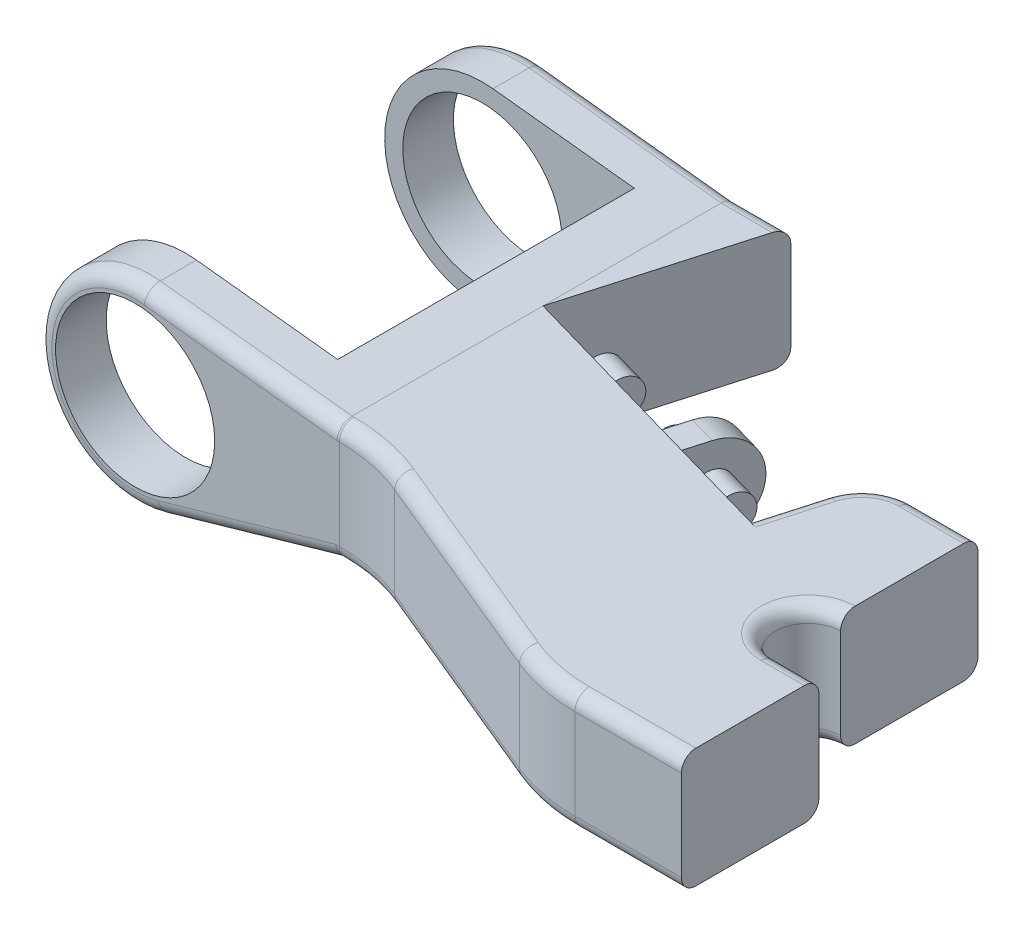
from build123d import *

# Parameters (mm, degrees)
EXTRUDE_1_DEPTH          = 13.5
CUT_EXTRUDE_1_DEPTH      = 136.073128342
CUT_EXTRUDE_1_DEPTH_BACK = 136.073128342
SKETCH_11_R              = 11
SKETCH_12_R              = 2.5
EXTRUDE_2_DEPTH          = 4.5
SKETCH_13_R              = 2.5
EXTRUDE_3_DEPTH          = 4.5
FILLET_1_R               = 25
EXTRUDE_START            = 4.5
EXTRUDE_5_DEPTH          = 4.5
EXTRUDE_6_DEPTH          = 4.5
CUT_EXTRUDE_5_DEPTH      = 4
FILLET_6_R               = 2


with BuildPart() as part:
    # Эскиз10 → Бобышка-Вытянуть1 (new, symmetric)
    with BuildSketch(Plane(origin=(0, 0, 0), x_dir=(1, 0, 0), z_dir=(0, 1, 0))):
        with BuildLine():
            Line((-78, 61.5), (-92.5, 61.5))
            Line((-92.5, 61.5), (-119.5, 61.5))
            Line((-119.5, 61.5), (-119.5, 54.5))
            Line((-119.5, 54.5), (-92.5, 54.5))
            Line((-92.5, 54.5), (-85, 54.5))
            Line((-85, 54.5), (-85, 13.5))
            Line((-85, 13.5), (-92.5, 13.5))
            Line((-92.5, 13.5), (-119.5, 13.5))
            Line((-119.5, 13.5), (-119.5, 6.5))
            Line((-119.5, 6.5), (-92.5, 6.5))
            Line((-92.5, 6.5), (-72.806349184, 6.5))
            Line((-72.806349184, 6.5), (-53.492640685, -1.5))
            Line((-53.492640685, -1.5), (-34.178932186, -9.5))
            Line((-34.178932186, -9.5), (-14.48528137, -9.5))
            Line((-14.48528137, -9.5), (-14.48528137, 9.5))
            Line((-14.48528137, 9.5), (-20.48528137, 9.5))
            ThreePointArc((-20.48528137, 9.5), (-24.98528137, 14), (-20.48528137, 18.5))
            Line((-20.48528137, 18.5), (-20.48528137, 37.5))
            Line((-20.48528137, 37.5), (-29.380741372, 37.5))
            ThreePointArc((-29.380741372, 37.5), (-33.710759363, 36.051196247), (-36.296953626, 32.288260244))
            Line((-36.296953626, 32.288260244), (-38.777689828, 23.636904981))
            Line((-38.777689828, 23.636904981), (-56.466321522, 28.7090385))
            Line((-56.466321522, 28.7090385), (-53.020854575, 40.724809699))
            Line((-53.020854575, 40.724809699), (-56.865901358, 41.827359122))
            Line((-56.865901358, 41.827359122), (-60.311368306, 29.811587923))
            Line((-60.311368306, 29.811587923), (-78, 34.883721442))
            Line((-78, 34.883721442), (-75.519263798, 43.535076705))
            Line((-75.519263798, 43.535076705), (-70.367904937, 61.5))
            Line((-70.367904937, 61.5), (-78, 61.5))
        make_face()
    extrude(amount=EXTRUDE_1_DEPTH, both=True)

    # Эскиз11 → Вырез-Вытянуть1 (cut, two sides: drawn at the far end of the back side and taken through both)
    with BuildSketch(Plane.XY.offset(-CUT_EXTRUDE_1_DEPTH_BACK)):
        with BuildLine():
            Line((-11.66726189, -13.5), (-11.66726189, -6))
            Line((-11.66726189, -6), (-78, -6))
            Line((-78, -6), (-102.271403318, -12.974882149))
            ThreePointArc((-102.271403318, -12.974882149), (-104.117303664, -13.368075946), (-106, -13.5))
            Line((-106, -13.5), (-11.66726189, -13.5))
        make_face()
        with BuildLine():
            Line((-78, 10.5), (-11.66726189, 10.5))
            Line((-11.66726189, 10.5), (-11.66726189, 13.5))
            Line((-11.66726189, 13.5), (-106, 13.5))
            ThreePointArc((-106, 13.5), (-105.260484121, 13.479729829), (-104.523188999, 13.418980187))
            Line((-104.523188999, 13.418980187), (-78, 10.5))
        make_face()
        with BuildLine():
            Line((-119.5, -13.5), (-106, -13.5))
            ThreePointArc((-106, -13.5), (-115.545941546, -9.545941546), (-119.5, 0))
            Line((-119.5, 0), (-119.5, -13.5))
        make_face()
        with BuildLine():
            ThreePointArc((-119.5, 0), (-115.545941546, 9.545941546), (-106, 13.5))
            Line((-106, 13.5), (-119.5, 13.5))
            Line((-119.5, 13.5), (-119.5, 0))
        make_face()
        with Locations((-106, 0)):
            Circle(SKETCH_11_R)
    extrude(amount=CUT_EXTRUDE_1_DEPTH + CUT_EXTRUDE_1_DEPTH_BACK, mode=Mode.SUBTRACT)

    # Эскиз12 → Бобышка-Вытянуть2 (add)
    with BuildSketch(Plane(origin=(-63.628022056, 0, -18.24504173), x_dir=(-0.2756373558168795, 0, 0.9612616959383532), z_dir=(-0.9612616959383532, 0, -0.2756373558168795))):
        with Locations((-18.53267148, 0)):
            Circle(SKETCH_12_R)
    extrude(amount=EXTRUDE_2_DEPTH)

    # Эскиз13 → Бобышка-Вытянуть3 (add)
    with BuildSketch(Plane(origin=(-42.094343578, 0, -12.070358788), x_dir=(-0.2756373558167246, 0, 0.9612616959383977), z_dir=(-0.9612616959383977, 0, -0.2756373558167246))):
        with Locations((-18.53267148, 0)):
            Circle(SKETCH_13_R)
    extrude(amount=EXTRUDE_3_DEPTH)

    # Скругление1
    fillet_1_edges = [part.edges().sort_by_distance(p)[0] for p in [
        (-34.178932186, 2.25, 9.5),
        (-72.806349184, 2.25, -6.5),
    ]]
    fillet(fillet_1_edges, radius=FILLET_1_R)

    # Эскиз21 → Бобышка-Вытянуть5 (add)
    with BuildSketch(Plane(origin=(-81.31665375, 0, -23.317175248), x_dir=(0.2756373558168807, 0, -0.9612616959383529), z_dir=(0.9612616959383529, 0, 0.2756373558168807)).offset(EXTRUDE_START)):
        with BuildLine():
            ThreePointArc((18.53267148, -2.5), (20.300438433, -1.767766953), (21.03267148, 0))
            ThreePointArc((21.03267148, 0), (16.764904527, 1.767766953), (18.53267148, -2.5))
        make_face()
    extrude(amount=-EXTRUDE_5_DEPTH)

    # Эскиз22 → Бобышка-Вытянуть6 (add)
    with BuildSketch(Plane(origin=(-59.782975272, 0, -17.142492306), x_dir=(0.27563735581687987, 0, -0.9612616959383531), z_dir=(0.9612616959383531, 0, 0.27563735581687987)).offset(EXTRUDE_START)):
        with BuildLine():
            ThreePointArc((18.53267148, -2.5), (20.300438433, -1.767766953), (21.03267148, 0))
            ThreePointArc((21.03267148, 0), (16.764904527, 1.767766953), (18.53267148, -2.5))
        make_face()
    extrude(amount=-EXTRUDE_6_DEPTH)

    # Эскиз24 → Вырез-Вытянуть5 (cut)
    with BuildSketch(Plane(origin=(-59.782975272, 0, -17.142492306), x_dir=(0.27563735581687987, 0, -0.9612616959383531), z_dir=(0.9612616959383531, 0, 0.27563735581687987))):
        with BuildLine():
            ThreePointArc((24.53267148, 0), (22.775312167, -4.242640687), (18.53267148, -6))
            Line((18.53267148, -6), (24.53267148, -6))
            Line((24.53267148, -6), (24.53267148, 0))
        make_face()
        with BuildLine():
            Line((12.03267148, 6), (18.53267148, 6))
            ThreePointArc((18.53267148, 6), (22.775312167, 4.242640687), (24.53267148, 0))
            Line((24.53267148, 0), (24.53267148, 10.5))
            Line((24.53267148, 10.5), (12.03267148, 10.5))
            Line((12.03267148, 10.5), (12.03267148, 6))
        make_face()
    extrude(amount=-CUT_EXTRUDE_5_DEPTH, mode=Mode.SUBTRACT)

    # Скругление6
    fillet_6_edges = [part.edges().sort_by_distance(p)[0] for p in [
        (-37.537321727, -6, -27.962582613),
        (-33.710759363, -6, -36.051196247),
        (-37.537321727, 10.5, -27.962582613),
        (-33.710759363, 10.5, -36.051196247),
        (-53.492640685, -6, 1.5),
        (-34.083381052, -6, 9.01963201),
        (-72.901900318, 10.5, -6.01963201),
        (-53.492640685, 10.5, 1.5),
        (-34.083381052, 10.5, 9.01963201),
        (-17.48528137, -6, -9.5),
        (-17.48528137, 10.5, -9.5),
        (-24.933011371, -6, -37.5),
        (-24.933011371, 10.5, -37.5),
        (-21.845702185, -6, 9.5),
        (-21.845702185, 10.5, 9.5),
        (-24.98528137, -6, -14),
        (-24.98528137, 10.5, -14),
        (-72.901900318, -6, -6.01963201),
        (-91.261594499, 11.959490094, -61.5),
        (-90.135701659, -9.487441074, -61.5),
        (-90.135701659, -9.487441074, -6.5),
        (-119.451135995, -1.147580261, -6.5),
        (-77.889579184, -6, -6.5),
        (-77.889579184, 10.5, -6.5),
        (-74.183952469, -6, -61.5),
        (-74.183952469, 10.5, -61.5),
        (-119.451135995, -1.147580261, -61.5),
        (-91.261594499, 11.959490094, -6.5),
    ]]
    fillet(fillet_6_edges, radius=FILLET_6_R)


solid = part.part
